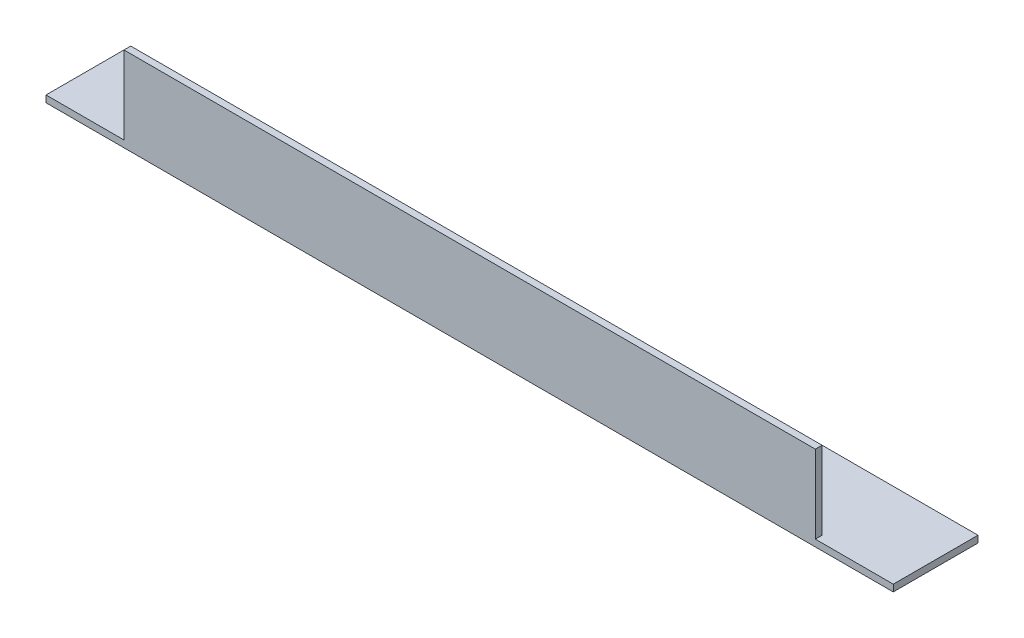
from build123d import *

# Parameters (mm, degrees)
EXTRUDE_1_DEPTH     = 250
SKETCH_2_W          = 23
SKETCH_2_H          = 23
CUT_EXTRUDE_1_DEPTH = 253.487623459


with BuildPart() as part:
    # Эскиз1 → Вытянуть-Тонкостенный1 (new body)
    with BuildSketch(Plane(origin=(0, 0, 0), x_dir=(0, 0, -1), z_dir=(1, 0, 0))):
        Polygon((0, 25), (0, 0), (25, 0), (25, 2), (2, 2), (2, 25), align=None)
    extrude(amount=EXTRUDE_1_DEPTH)

    # Эскиз2 → Вырез-Вытянуть1 (cut, through all)
    with BuildSketch(Plane.XY):
        with Locations((238.5, 13.5)):
            Rectangle(SKETCH_2_W, SKETCH_2_H)
        with Locations((11.5, 13.5)):
            Rectangle(SKETCH_2_W, SKETCH_2_H)
    extrude(amount=-CUT_EXTRUDE_1_DEPTH, mode=Mode.SUBTRACT)


solid = part.part
